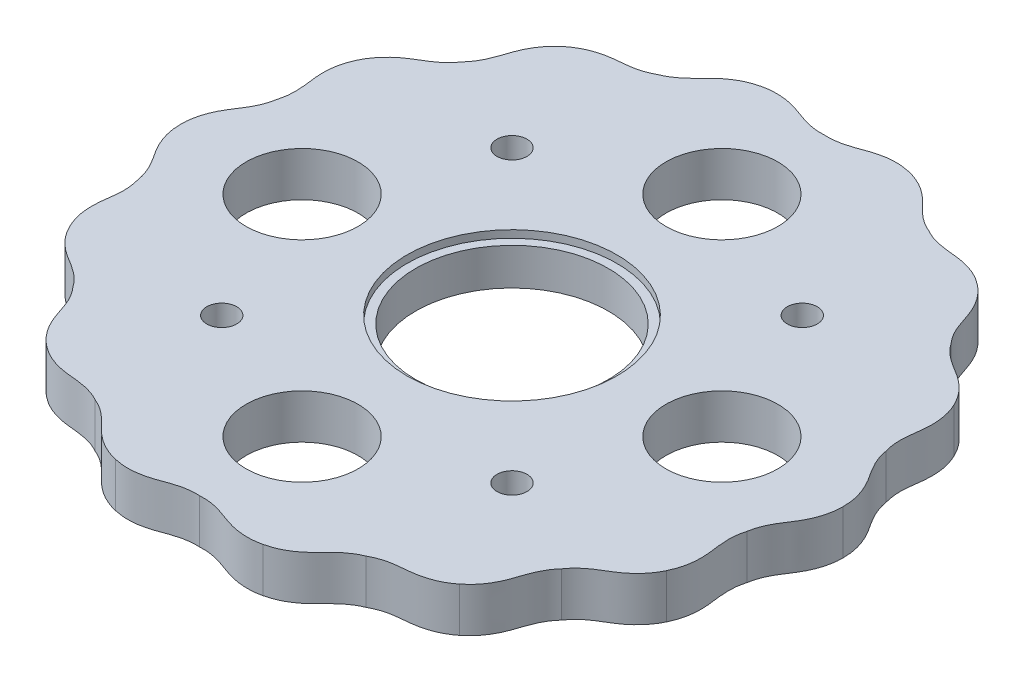
from build123d import *

# Parameters (mm, degrees)
BOSS_EXTRUDE3_DEPTH = 4.7625
SKETCH2_R           = 10.328125
SKETCH2_R_2         = 6
CUT_EXTRUDE1_DEPTH  = 4.7625
SKETCH2_4_R         = 1.607
CUT_EXTRUDE2_DEPTH  = 2.4105
SKETCH3_R           = 11.25
CUT_EXTRUDE3_DEPTH  = 0.8


with BuildPart() as part:
    # Sketch1 → Boss-Extrude3 (new body)
    with BuildSketch(Plane(origin=(0, 0, 0), x_dir=(1, 0, 0), z_dir=(0, 1, 0))):
        with BuildLine():
            Line((35.500002326, 0.003735881), (35.500002326, 0))
            Line((35.500002326, 0), (35.500002326, -0.003735881))
            add(Edge.make_bspline(
                [(32.644810899, -7.45096506), (32.674793712, -7.260710929), (32.757965618, -6.873262555), (32.975088878, -6.197475635), (33.30681421, -5.487322542), (33.693887271, -4.83935734), (34.139372051, -4.165162167), (34.499748971, -3.6014921), (34.870711868, -2.889611748), (35.149566879, -2.192738575), (35.418263863, -1.23361479), (35.50061524, -0.495919336), (35.500002326, -0.003735881)],
                knots=[0.02301065, 0.02301065, 0.02301065, 0.02301065, 0.053541567, 0.084072485, 0.145134319, 0.206196153, 0.267257988, 0.389381656, 0.511505325, 0.633628994, 0.755752663, 1, 1, 1, 1], degree=3))
            add(Edge.make_bspline(
                [(31.986017844, -15.399507835), (32.200120458, -14.956331799), (32.445998494, -14.255960238), (32.62005909, -13.275236314), (32.671181344, -12.526384626), (32.645828632, -11.724047822), (32.565707523, -11.059836954), (32.456861927, -10.25911949), (32.389262714, -9.507378309), (32.398512397, -8.723622254), (32.496104055, -8.020553026), (32.589276306, -7.635387164), (32.644810899, -7.45096506)],
                knots=[0.02301065, 0.02301065, 0.02301065, 0.02301065, 0.267257988, 0.389381656, 0.511505325, 0.633628994, 0.755752663, 0.816814497, 0.877876331, 0.938938166, 0.969469083, 1, 1, 1, 1], degree=3))
            Line((31.986017844, -15.399507835), (31.984396906, -15.402873748))
            Line((31.984396906, -15.402873748), (31.982775968, -15.406239661))
            add(Edge.make_bspline(
                [(26.179105738, -20.877140171), (26.288667493, -20.718736177), (26.531710341, -20.405744191), (27.020544594, -19.891087467), (27.62754267, -19.395191866), (28.257425012, -18.979340099), (28.951315253, -18.565199839), (29.520570914, -18.213712342), (30.163670245, -17.733285076), (30.717271866, -17.226414698), (31.375507699, -16.478857279), (31.769777787, -15.849947564), (31.982775968, -15.406239661)],
                knots=[0.02301065, 0.02301065, 0.02301065, 0.02301065, 0.053541567, 0.084072485, 0.145134319, 0.206196153, 0.267257988, 0.389381656, 0.511505325, 0.633628994, 0.755752663, 1, 1, 1, 1], degree=3))
            add(Edge.make_bspline(
                [(22.136810246, -27.752690162), (22.521996911, -27.446297993), (23.047405198, -26.921967502), (23.62974854, -26.113887841), (24.00072267, -25.461376898), (24.326001557, -24.727496287), (24.542005228, -24.094299727), (24.791357022, -23.325651886), (25.05662051, -22.619026286), (25.405013194, -21.916899767), (25.797990545, -21.325799714), (26.049053047, -21.019203188), (26.179105738, -20.877140171)],
                knots=[0.02301065, 0.02301065, 0.02301065, 0.02301065, 0.267257988, 0.389381656, 0.511505325, 0.633628994, 0.755752663, 0.816814497, 0.877876331, 0.938938166, 0.969469083, 1, 1, 1, 1], degree=3))
            Line((22.136810246, -27.752690162), (22.133889416, -27.755019446))
            Line((22.133889416, -27.755019446), (22.130968587, -27.75734873))
            add(Edge.make_bspline(
                [(14.52830762, -30.168341629), (14.695748267, -30.073161626), (15.05052444, -29.89661793), (15.714250068, -29.645025478), (16.476297475, -29.461605575), (17.224233175, -29.360231784), (18.029095404, -29.288171996), (18.694481743, -29.218483478), (19.482343797, -29.064663811), (20.201044438, -28.848188121), (21.118447439, -28.460259983), (21.746546212, -28.06469929), (22.130968587, -27.75734873)],
                knots=[0.02301065, 0.02301065, 0.02301065, 0.02301065, 0.053541567, 0.084072485, 0.145134319, 0.206196153, 0.267257988, 0.389381656, 0.511505325, 0.633628994, 0.755752663, 1, 1, 1, 1], degree=3))
            add(Edge.make_bspline(
                [(7.903135888, -34.609111839), (8.383115662, -34.500188263), (9.083990645, -34.255748926), (9.959276491, -33.780363616), (10.576626521, -33.353431213), (11.188111536, -32.833360849), (11.657457809, -32.356590942), (12.215619812, -31.772252855), (12.761207314, -31.250698702), (13.379739556, -30.769266488), (13.990268616, -30.407210225), (14.349495361, -30.239908237), (14.52830762, -30.168341629)],
                knots=[0.02301065, 0.02301065, 0.02301065, 0.02301065, 0.267257988, 0.389381656, 0.511505325, 0.633628994, 0.755752663, 0.816814497, 0.877876331, 0.938938166, 0.969469083, 1, 1, 1, 1], degree=3))
            Line((7.903135888, -34.609111839), (7.899493673, -34.60994315))
            Line((7.899493673, -34.60994315), (7.895851458, -34.610774462))
            add(Edge.make_bspline(
                [(0, -33.484333037), (0.192155866, -33.471228592), (0.588397592, -33.466099831), (1.295555593, -33.527402621), (2.061719496, -33.692786976), (2.779570716, -33.925969485), (3.535992098, -34.210262493), (4.165721189, -34.43617562), (4.942300224, -34.639429423), (5.683752409, -34.756224087), (6.678619663, -34.804759157), (7.416144457, -34.72089313), (7.895851458, -34.610774462)],
                knots=[0.02301065, 0.02301065, 0.02301065, 0.02301065, 0.053541567, 0.084072485, 0.145134319, 0.206196153, 0.267257988, 0.389381656, 0.511505325, 0.633628994, 0.755752663, 1, 1, 1, 1], degree=3))
            add(Edge.make_bspline(
                [(-7.895851458, -34.610774462), (-7.416144457, -34.72089313), (-6.678619663, -34.804759157), (-5.683752409, -34.756224087), (-4.942300224, -34.639429423), (-4.165721189, -34.43617562), (-3.535992098, -34.210262493), (-2.779570716, -33.925969485), (-2.061719496, -33.692786976), (-1.295555593, -33.527402621), (-0.588397592, -33.466099831), (-0.192155866, -33.471228592), (0, -33.484333037)],
                knots=[0.02301065, 0.02301065, 0.02301065, 0.02301065, 0.267257988, 0.389381656, 0.511505325, 0.633628994, 0.755752663, 0.816814497, 0.877876331, 0.938938166, 0.969469083, 1, 1, 1, 1], degree=3))
            Line((-7.895851458, -34.610774462), (-7.899493673, -34.60994315))
            Line((-7.899493673, -34.60994315), (-7.903135888, -34.609111839))
            add(Edge.make_bspline(
                [(-14.52830762, -30.168341629), (-14.349495361, -30.239908237), (-13.990268616, -30.407210225), (-13.379739556, -30.769266488), (-12.761207314, -31.250698702), (-12.215619812, -31.772252855), (-11.657457809, -32.356590942), (-11.188111536, -32.833360849), (-10.576626521, -33.353431213), (-9.959276491, -33.780363616), (-9.083990645, -34.255748926), (-8.383115662, -34.500188263), (-7.903135888, -34.609111839)],
                knots=[0.02301065, 0.02301065, 0.02301065, 0.02301065, 0.053541567, 0.084072485, 0.145134319, 0.206196153, 0.267257988, 0.389381656, 0.511505325, 0.633628994, 0.755752663, 1, 1, 1, 1], degree=3))
            add(Edge.make_bspline(
                [(-22.130968587, -27.75734873), (-21.746546212, -28.06469929), (-21.118447439, -28.460259983), (-20.201044438, -28.848188121), (-19.482343797, -29.064663811), (-18.694481743, -29.218483478), (-18.029095404, -29.288171996), (-17.224233175, -29.360231784), (-16.476297475, -29.461605575), (-15.714250068, -29.645025478), (-15.05052444, -29.89661793), (-14.695748267, -30.073161626), (-14.52830762, -30.168341629)],
                knots=[0.02301065, 0.02301065, 0.02301065, 0.02301065, 0.267257988, 0.389381656, 0.511505325, 0.633628994, 0.755752663, 0.816814497, 0.877876331, 0.938938166, 0.969469083, 1, 1, 1, 1], degree=3))
            Line((-22.130968587, -27.75734873), (-22.133889416, -27.755019446))
            Line((-22.133889416, -27.755019446), (-22.136810246, -27.752690162))
            add(Edge.make_bspline(
                [(-26.179105738, -20.877140171), (-26.049053047, -21.019203188), (-25.797990545, -21.325799714), (-25.405013194, -21.916899767), (-25.05662051, -22.619026286), (-24.791357022, -23.325651886), (-24.542005228, -24.094299727), (-24.326001557, -24.727496287), (-24.00072267, -25.461376898), (-23.62974854, -26.113887841), (-23.047405198, -26.921967502), (-22.521996911, -27.446297993), (-22.136810246, -27.752690162)],
                knots=[0.02301065, 0.02301065, 0.02301065, 0.02301065, 0.053541567, 0.084072485, 0.145134319, 0.206196153, 0.267257988, 0.389381656, 0.511505325, 0.633628994, 0.755752663, 1, 1, 1, 1], degree=3))
            add(Edge.make_bspline(
                [(-31.982775968, -15.406239661), (-31.769777787, -15.849947564), (-31.375507698, -16.478857279), (-30.717271866, -17.226414698), (-30.163670245, -17.733285076), (-29.520570914, -18.213712342), (-28.951315253, -18.565199839), (-28.257425012, -18.979340099), (-27.62754267, -19.395191866), (-27.020544594, -19.891087467), (-26.531710341, -20.405744191), (-26.288667493, -20.718736177), (-26.179105738, -20.877140171)],
                knots=[0.02301065, 0.02301065, 0.02301065, 0.02301065, 0.267257988, 0.389381656, 0.511505325, 0.633628994, 0.755752663, 0.816814497, 0.877876331, 0.938938166, 0.969469083, 1, 1, 1, 1], degree=3))
            Line((-31.982775968, -15.406239661), (-31.984396906, -15.402873748))
            Line((-31.984396906, -15.402873748), (-31.986017844, -15.399507835))
            add(Edge.make_bspline(
                [(-32.644810899, -7.45096506), (-32.589276306, -7.635387164), (-32.496104055, -8.020553026), (-32.398512397, -8.723622254), (-32.389262714, -9.507378309), (-32.456861927, -10.25911949), (-32.565707523, -11.059836954), (-32.645828632, -11.724047822), (-32.671181344, -12.526384626), (-32.62005909, -13.275236314), (-32.445998494, -14.255960238), (-32.200120458, -14.956331799), (-31.986017844, -15.399507835)],
                knots=[0.02301065, 0.02301065, 0.02301065, 0.02301065, 0.053541567, 0.084072485, 0.145134319, 0.206196153, 0.267257988, 0.389381656, 0.511505325, 0.633628994, 0.755752663, 1, 1, 1, 1], degree=3))
            add(Edge.make_bspline(
                [(-35.500002326, -0.003735881), (-35.50061524, -0.495919336), (-35.418263863, -1.23361479), (-35.149566879, -2.192738575), (-34.870711868, -2.889611748), (-34.499748971, -3.6014921), (-34.139372051, -4.165162167), (-33.693887271, -4.83935734), (-33.30681421, -5.487322542), (-32.975088878, -6.197475635), (-32.757965618, -6.873262555), (-32.674793712, -7.260710929), (-32.644810899, -7.45096506)],
                knots=[0.02301065, 0.02301065, 0.02301065, 0.02301065, 0.267257988, 0.389381656, 0.511505325, 0.633628994, 0.755752663, 0.816814497, 0.877876331, 0.938938166, 0.969469083, 1, 1, 1, 1], degree=3))
            Line((-35.500002326, -0.003735881), (-35.500002326, 0))
            Line((-35.500002326, 0), (-35.500002326, 0.003735881))
            add(Edge.make_bspline(
                [(-32.644810899, 7.45096506), (-32.674793712, 7.260710929), (-32.757965618, 6.873262555), (-32.975088878, 6.197475635), (-33.30681421, 5.487322542), (-33.693887271, 4.83935734), (-34.139372051, 4.165162167), (-34.499748971, 3.6014921), (-34.870711868, 2.889611748), (-35.149566879, 2.192738575), (-35.418263863, 1.23361479), (-35.50061524, 0.495919336), (-35.500002326, 0.003735881)],
                knots=[0.02301065, 0.02301065, 0.02301065, 0.02301065, 0.053541567, 0.084072485, 0.145134319, 0.206196153, 0.267257988, 0.389381656, 0.511505325, 0.633628994, 0.755752663, 1, 1, 1, 1], degree=3))
            add(Edge.make_bspline(
                [(-31.986017844, 15.399507835), (-32.200120458, 14.956331799), (-32.445998494, 14.255960238), (-32.62005909, 13.275236314), (-32.671181344, 12.526384626), (-32.645828632, 11.724047822), (-32.565707523, 11.059836954), (-32.456861927, 10.25911949), (-32.389262714, 9.507378309), (-32.398512397, 8.723622254), (-32.496104055, 8.020553026), (-32.589276306, 7.635387164), (-32.644810899, 7.45096506)],
                knots=[0.02301065, 0.02301065, 0.02301065, 0.02301065, 0.267257988, 0.389381656, 0.511505325, 0.633628994, 0.755752663, 0.816814497, 0.877876331, 0.938938166, 0.969469083, 1, 1, 1, 1], degree=3))
            Line((-31.986017844, 15.399507835), (-31.984396906, 15.402873748))
            Line((-31.984396906, 15.402873748), (-31.982775968, 15.406239661))
            add(Edge.make_bspline(
                [(-26.179105738, 20.877140171), (-26.288667493, 20.718736177), (-26.531710341, 20.405744191), (-27.020544594, 19.891087467), (-27.62754267, 19.395191866), (-28.257425012, 18.979340099), (-28.951315253, 18.565199839), (-29.520570914, 18.213712342), (-30.163670245, 17.733285076), (-30.717271866, 17.226414698), (-31.375507699, 16.478857278), (-31.769777787, 15.849947564), (-31.982775968, 15.406239661)],
                knots=[0.02301065, 0.02301065, 0.02301065, 0.02301065, 0.053541567, 0.084072485, 0.145134319, 0.206196153, 0.267257988, 0.389381656, 0.511505325, 0.633628994, 0.755752663, 1, 1, 1, 1], degree=3))
            add(Edge.make_bspline(
                [(-22.136810246, 27.752690162), (-22.521996911, 27.446297993), (-23.047405198, 26.921967502), (-23.62974854, 26.113887841), (-24.00072267, 25.461376898), (-24.326001557, 24.727496287), (-24.542005228, 24.094299727), (-24.791357022, 23.325651886), (-25.05662051, 22.619026286), (-25.405013194, 21.916899767), (-25.797990545, 21.325799714), (-26.049053047, 21.019203188), (-26.179105738, 20.877140171)],
                knots=[0.02301065, 0.02301065, 0.02301065, 0.02301065, 0.267257988, 0.389381656, 0.511505325, 0.633628994, 0.755752663, 0.816814497, 0.877876331, 0.938938166, 0.969469083, 1, 1, 1, 1], degree=3))
            Line((-22.136810246, 27.752690162), (-22.133889416, 27.755019446))
            Line((-22.133889416, 27.755019446), (-22.130968587, 27.75734873))
            add(Edge.make_bspline(
                [(-14.52830762, 30.168341629), (-14.695748267, 30.073161626), (-15.05052444, 29.89661793), (-15.714250068, 29.645025478), (-16.476297475, 29.461605575), (-17.224233175, 29.360231784), (-18.029095404, 29.288171996), (-18.694481743, 29.218483478), (-19.482343797, 29.064663811), (-20.201044438, 28.848188121), (-21.118447439, 28.460259983), (-21.746546212, 28.06469929), (-22.130968587, 27.75734873)],
                knots=[0.02301065, 0.02301065, 0.02301065, 0.02301065, 0.053541567, 0.084072485, 0.145134319, 0.206196153, 0.267257988, 0.389381656, 0.511505325, 0.633628994, 0.755752663, 1, 1, 1, 1], degree=3))
            add(Edge.make_bspline(
                [(-7.903135888, 34.609111839), (-8.383115662, 34.500188263), (-9.083990645, 34.255748926), (-9.959276491, 33.780363616), (-10.576626521, 33.353431213), (-11.188111536, 32.833360849), (-11.657457809, 32.356590942), (-12.215619812, 31.772252855), (-12.761207314, 31.250698702), (-13.379739556, 30.769266488), (-13.990268616, 30.407210225), (-14.349495361, 30.239908237), (-14.52830762, 30.168341629)],
                knots=[0.02301065, 0.02301065, 0.02301065, 0.02301065, 0.267257988, 0.389381656, 0.511505325, 0.633628994, 0.755752663, 0.816814497, 0.877876331, 0.938938166, 0.969469083, 1, 1, 1, 1], degree=3))
            Line((-7.903135888, 34.609111839), (-7.899493673, 34.60994315))
            Line((-7.899493673, 34.60994315), (-7.895851458, 34.610774462))
            add(Edge.make_bspline(
                [(0, 33.484333037), (-0.192155866, 33.471228592), (-0.588397592, 33.466099831), (-1.295555593, 33.527402621), (-2.061719496, 33.692786976), (-2.779570716, 33.925969485), (-3.535992098, 34.210262493), (-4.165721189, 34.43617562), (-4.942300224, 34.639429423), (-5.683752409, 34.756224087), (-6.678619663, 34.804759157), (-7.416144457, 34.72089313), (-7.895851458, 34.610774462)],
                knots=[0.02301065, 0.02301065, 0.02301065, 0.02301065, 0.053541567, 0.084072485, 0.145134319, 0.206196153, 0.267257988, 0.389381656, 0.511505325, 0.633628994, 0.755752663, 1, 1, 1, 1], degree=3))
            add(Edge.make_bspline(
                [(7.895851458, 34.610774462), (7.416144457, 34.72089313), (6.678619663, 34.804759157), (5.683752409, 34.756224087), (4.942300224, 34.639429423), (4.165721189, 34.43617562), (3.535992098, 34.210262493), (2.779570716, 33.925969485), (2.061719496, 33.692786976), (1.295555593, 33.527402621), (0.588397592, 33.466099831), (0.192155866, 33.471228592), (0, 33.484333037)],
                knots=[0.02301065, 0.02301065, 0.02301065, 0.02301065, 0.267257988, 0.389381656, 0.511505325, 0.633628994, 0.755752663, 0.816814497, 0.877876331, 0.938938166, 0.969469083, 1, 1, 1, 1], degree=3))
            Line((7.895851458, 34.610774462), (7.899493673, 34.60994315))
            Line((7.899493673, 34.60994315), (7.903135888, 34.609111839))
            add(Edge.make_bspline(
                [(14.52830762, 30.168341629), (14.349495361, 30.239908237), (13.990268616, 30.407210225), (13.379739556, 30.769266488), (12.761207314, 31.250698702), (12.215619812, 31.772252855), (11.657457809, 32.356590942), (11.188111536, 32.833360849), (10.576626521, 33.353431213), (9.959276491, 33.780363616), (9.083990645, 34.255748926), (8.383115662, 34.500188263), (7.903135888, 34.609111839)],
                knots=[0.02301065, 0.02301065, 0.02301065, 0.02301065, 0.053541567, 0.084072485, 0.145134319, 0.206196153, 0.267257988, 0.389381656, 0.511505325, 0.633628994, 0.755752663, 1, 1, 1, 1], degree=3))
            add(Edge.make_bspline(
                [(22.130968587, 27.75734873), (21.746546212, 28.06469929), (21.118447439, 28.460259983), (20.201044438, 28.848188121), (19.482343797, 29.064663811), (18.694481743, 29.218483478), (18.029095404, 29.288171996), (17.224233175, 29.360231784), (16.476297475, 29.461605575), (15.714250068, 29.645025478), (15.05052444, 29.89661793), (14.695748267, 30.073161626), (14.52830762, 30.168341629)],
                knots=[0.02301065, 0.02301065, 0.02301065, 0.02301065, 0.267257988, 0.389381656, 0.511505325, 0.633628994, 0.755752663, 0.816814497, 0.877876331, 0.938938166, 0.969469083, 1, 1, 1, 1], degree=3))
            Line((22.130968587, 27.75734873), (22.133889416, 27.755019446))
            Line((22.133889416, 27.755019446), (22.136810246, 27.752690162))
            add(Edge.make_bspline(
                [(26.179105738, 20.877140171), (26.049053047, 21.019203188), (25.797990545, 21.325799714), (25.405013194, 21.916899767), (25.05662051, 22.619026286), (24.791357022, 23.325651886), (24.542005228, 24.094299727), (24.326001557, 24.727496287), (24.00072267, 25.461376898), (23.62974854, 26.113887841), (23.047405198, 26.921967502), (22.521996911, 27.446297993), (22.136810246, 27.752690162)],
                knots=[0.02301065, 0.02301065, 0.02301065, 0.02301065, 0.053541567, 0.084072485, 0.145134319, 0.206196153, 0.267257988, 0.389381656, 0.511505325, 0.633628994, 0.755752663, 1, 1, 1, 1], degree=3))
            add(Edge.make_bspline(
                [(31.982775968, 15.406239661), (31.769777787, 15.849947564), (31.375507698, 16.478857279), (30.717271866, 17.226414698), (30.163670245, 17.733285076), (29.520570914, 18.213712342), (28.951315253, 18.565199839), (28.257425012, 18.979340099), (27.62754267, 19.395191866), (27.020544594, 19.891087467), (26.531710341, 20.405744191), (26.288667493, 20.718736177), (26.179105738, 20.877140171)],
                knots=[0.02301065, 0.02301065, 0.02301065, 0.02301065, 0.267257988, 0.389381656, 0.511505325, 0.633628994, 0.755752663, 0.816814497, 0.877876331, 0.938938166, 0.969469083, 1, 1, 1, 1], degree=3))
            Line((31.982775968, 15.406239661), (31.984396906, 15.402873748))
            Line((31.984396906, 15.402873748), (31.986017844, 15.399507835))
            add(Edge.make_bspline(
                [(32.644810899, 7.45096506), (32.589276306, 7.635387164), (32.496104055, 8.020553026), (32.398512397, 8.723622254), (32.389262714, 9.507378309), (32.456861927, 10.25911949), (32.565707523, 11.059836954), (32.645828632, 11.724047822), (32.671181344, 12.526384626), (32.62005909, 13.275236314), (32.445998494, 14.255960238), (32.200120458, 14.956331799), (31.986017844, 15.399507835)],
                knots=[0.02301065, 0.02301065, 0.02301065, 0.02301065, 0.053541567, 0.084072485, 0.145134319, 0.206196153, 0.267257988, 0.389381656, 0.511505325, 0.633628994, 0.755752663, 1, 1, 1, 1], degree=3))
            add(Edge.make_bspline(
                [(35.500002326, 0.003735881), (35.50061524, 0.495919336), (35.418263863, 1.23361479), (35.149566879, 2.192738575), (34.870711868, 2.889611748), (34.499748971, 3.6014921), (34.139372051, 4.165162167), (33.693887271, 4.83935734), (33.30681421, 5.487322542), (32.975088878, 6.197475635), (32.757965618, 6.873262555), (32.674793712, 7.260710929), (32.644810899, 7.45096506)],
                knots=[0.02301065, 0.02301065, 0.02301065, 0.02301065, 0.267257988, 0.389381656, 0.511505325, 0.633628994, 0.755752663, 0.816814497, 0.877876331, 0.938938166, 0.969469083, 1, 1, 1, 1], degree=3))
        make_face()
    extrude(amount=BOSS_EXTRUDE3_DEPTH)

    # Sketch2 → Cut-Extrude1 (cut)
    with BuildSketch(Plane(origin=(0, 4.7625, 0), x_dir=(1, 0, 0), z_dir=(0, 1, 0))):
        Circle(SKETCH2_R)
        with Locations((22.5, 0)):
            Circle(SKETCH2_R_2)
        with Locations((0, -22.5)):
            Circle(SKETCH2_R_2)
        with Locations((-22.5, 0)):
            Circle(SKETCH2_R_2)
        with Locations((0, 22.5)):
            Circle(SKETCH2_R_2)
    extrude(amount=-CUT_EXTRUDE1_DEPTH, mode=Mode.SUBTRACT)

    # Sketch2<4> → Cut-Extrude2 (cut)
    with BuildSketch(Plane(origin=(0, 4.7625, 0), x_dir=(1, 0, 0), z_dir=(0, 1, 0))):
        with Locations((15.556349186, 15.556349186)):
            Circle(SKETCH2_4_R)
        with Locations((15.556349186, -15.556349186)):
            Circle(SKETCH2_4_R)
        with Locations((-15.556349186, -15.556349186)):
            Circle(SKETCH2_4_R)
        with Locations((-15.556349186, 15.556349186)):
            Circle(SKETCH2_4_R)
    extrude(amount=-CUT_EXTRUDE2_DEPTH, mode=Mode.SUBTRACT)

    # Sketch3 → Cut-Extrude3 (cut)
    with BuildSketch(Plane(origin=(0, 4.7625, 0), x_dir=(1, 0, 0), z_dir=(0, 1, 0))):
        Circle(SKETCH3_R)
    extrude(amount=-CUT_EXTRUDE3_DEPTH, mode=Mode.SUBTRACT)


solid = part.part
